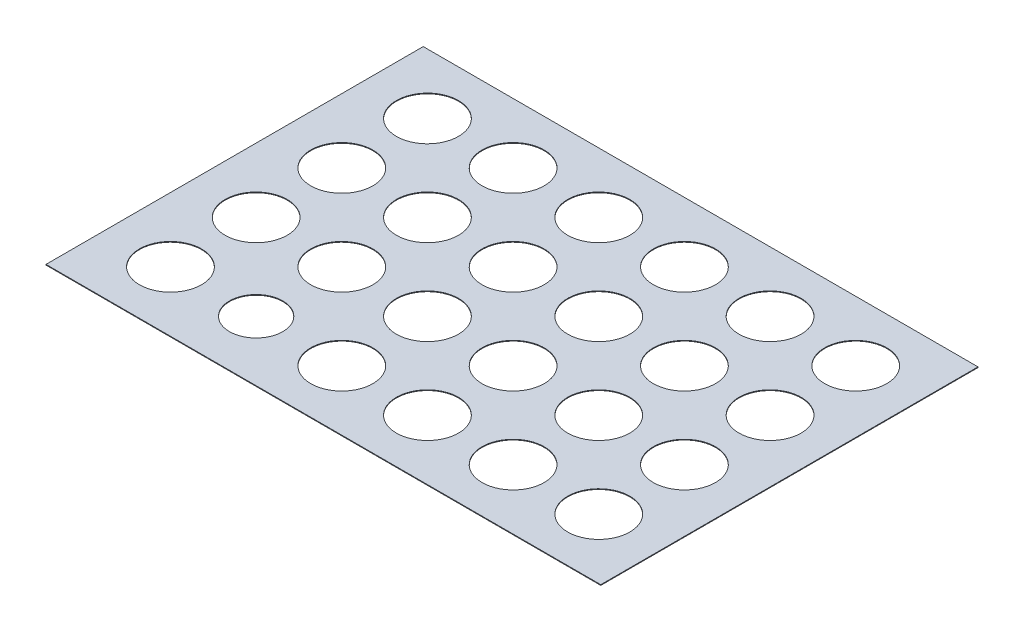
from build123d import *

# Parameters (mm, degrees)
SKETCH1_W           = 125
SKETCH1_H           = 85
BOSS_EXTRUDE1_DEPTH = 0.15
SKETCH2_R           = 7
SKETCH2_R_2         = 6.005641262
CUT_EXTRUDE1_DEPTH  = 0.15


with BuildPart() as part:
    # Sketch1 → Boss-Extrude1 (new body)
    with BuildSketch(Plane(origin=(0, 0, 0), x_dir=(1, 0, 0), z_dir=(0, 1, 0))):
        with Locations((62.5, 42.5)):
            Rectangle(SKETCH1_W, SKETCH1_H)
    extrude(amount=BOSS_EXTRUDE1_DEPTH)

    # Sketch2 → Cut-Extrude1 (cut)
    with BuildSketch(Plane(origin=(0, 0.15, 0), x_dir=(1, 0, 0), z_dir=(0, 1, 0))):
        with Locations((14.5, 13.55)):
            Circle(SKETCH2_R)
        with Locations((14.5, 32.85)):
            Circle(SKETCH2_R)
        with Locations((14.5, 52.15)):
            Circle(SKETCH2_R)
        with Locations((14.5, 71.45)):
            Circle(SKETCH2_R)
        with Locations((33.8, 71.45)):
            Circle(SKETCH2_R)
        with Locations((53.1, 71.45)):
            Circle(SKETCH2_R)
        with Locations((72.4, 71.45)):
            Circle(SKETCH2_R)
        with Locations((91.7, 71.45)):
            Circle(SKETCH2_R)
        with Locations((111, 71.45)):
            Circle(SKETCH2_R)
        with Locations((33.8, 52.15)):
            Circle(SKETCH2_R)
        with Locations((33.8, 32.85)):
            Circle(SKETCH2_R)
        with Locations((53.1, 52.15)):
            Circle(SKETCH2_R)
        with Locations((53.1, 32.85)):
            Circle(SKETCH2_R)
        with Locations((72.4, 52.15)):
            Circle(SKETCH2_R)
        with Locations((91.7, 52.15)):
            Circle(SKETCH2_R)
        with Locations((111, 52.15)):
            Circle(SKETCH2_R)
        with Locations((72.4, 32.85)):
            Circle(SKETCH2_R)
        with Locations((91.7, 32.85)):
            Circle(SKETCH2_R)
        with Locations((111, 32.85)):
            Circle(SKETCH2_R)
        with Locations((33.8, 13.55)):
            Circle(SKETCH2_R_2)
        with Locations((53.1, 13.55)):
            Circle(SKETCH2_R)
        with Locations((72.4, 13.55)):
            Circle(SKETCH2_R)
        with Locations((91.7, 13.55)):
            Circle(SKETCH2_R)
        with Locations((111, 13.55)):
            Circle(SKETCH2_R)
    extrude(amount=-CUT_EXTRUDE1_DEPTH, mode=Mode.SUBTRACT)


solid = part.part
